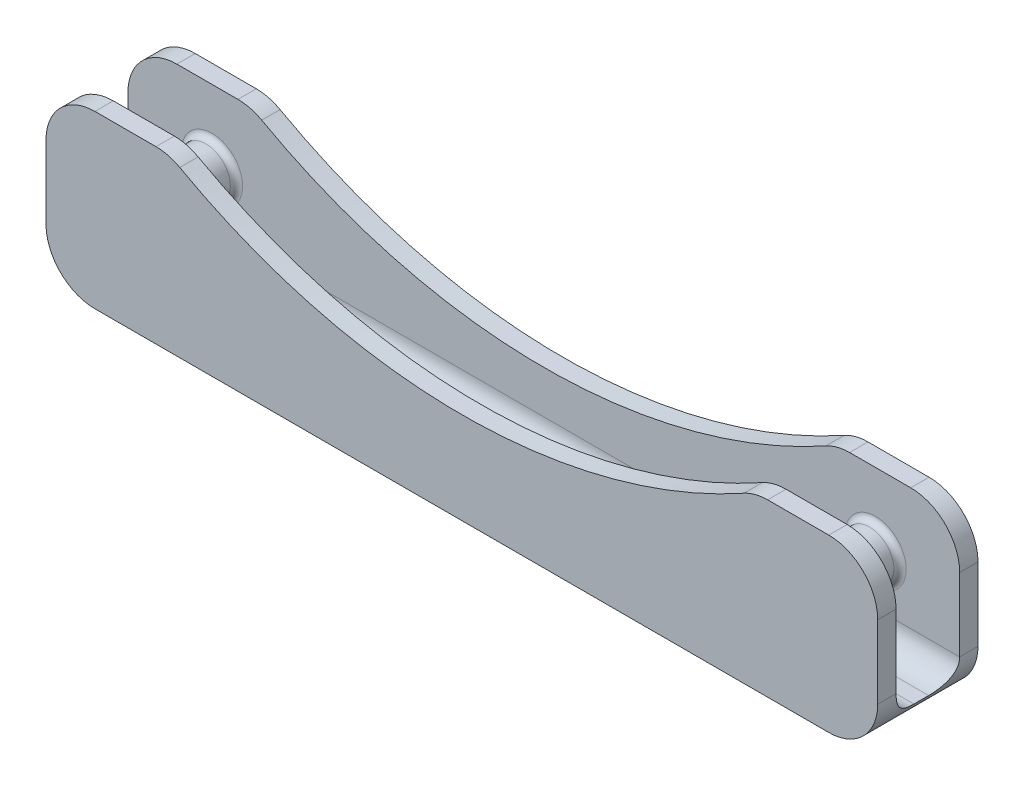
from build123d import *

# Parameters (mm, degrees)
BOSS_EXTRUDE1_DEPTH     = 3
SKETCH2_R               = 4
SKETCH2_W               = 200
SKETCH2_H               = 4
BOSS_EXTRUDE2_DEPTH     = 5.2
CUT_EXTRUDE3_DEPTH      = 149.751605033
CUT_EXTRUDE3_DEPTH_BACK = 149.751605033
SKETCH4_W               = 200.256598964
SKETCH4_H               = 45.821107358
CUT_EXTRUDE4_DEPTH      = 149.886668308
CUT_EXTRUDE4_DEPTH_BACK = 149.886668308
SKETCH5_W               = 32
SKETCH5_H               = 27.954907266
FILLET1_R               = 1
FILLET2_R               = 4
FILLET3_R               = 8
FILLET4_R               = 8


with BuildPart() as part:
    # Sketch1 → Boss-Extrude1 (new body)
    with BuildSketch(Plane.XY):
        with BuildLine():
            ThreePointArc((0, -110), (-59.410296816, -92.57654472), (-100, -45.82575695))
            Line((-100, -45.82575695), (-100, -110))
            Line((-100, -110), (0, -110))
        make_face()
        with BuildLine():
            ThreePointArc((0, -95), (-51.308892705, -79.95247044), (-86.363636364, -39.576790093))
            Line((-86.363636364, -39.576790093), (-100, -45.82575695))
            ThreePointArc((-100, -45.82575695), (-59.410296816, -92.57654472), (0, -110))
            Line((0, -110), (0, -95))
        make_face()
        with BuildLine():
            Line((100, -45.82575695), (86.363636364, -39.576790093))
            ThreePointArc((86.363636364, -39.576790093), (51.308892705, -79.95247044), (0, -95))
            Line((0, -95), (0, -110))
            ThreePointArc((0, -110), (59.410296816, -92.57654472), (100, -45.82575695))
        make_face()
        with BuildLine():
            Line((100, -110), (100, -45.82575695))
            ThreePointArc((100, -45.82575695), (59.410296816, -92.57654472), (0, -110))
            Line((0, -110), (100, -110))
        make_face()
    extrude(amount=BOSS_EXTRUDE1_DEPTH)

    # Sketch2 → Boss-Extrude2 (add)
    with BuildSketch(Plane.XY.offset(3)):
        with Locations((-54.25, -93.963756311)):
            Circle(SKETCH2_R)
        with Locations((54.25, -93.963756311)):
            Circle(SKETCH2_R)
        with Locations((0, -108)):
            Rectangle(SKETCH2_W, SKETCH2_H)
    extrude(amount=BOSS_EXTRUDE2_DEPTH)

    # Sketch4 → Cut-Extrude3 (cut, two sides: drawn at the far end of the back side and taken through both)
    with BuildSketch(Plane.XY.offset(3).offset(-CUT_EXTRUDE3_DEPTH_BACK)):
        with Locations((0.128299482, -59.134539055)):
            Rectangle(SKETCH4_W, SKETCH4_H)
    extrude(amount=CUT_EXTRUDE3_DEPTH + CUT_EXTRUDE3_DEPTH_BACK, mode=Mode.SUBTRACT)

    # Sketch5 → Cut-Extrude4 (cut, two sides: drawn at the far end of the back side and taken through both)
    with BuildSketch(Plane(origin=(0, 0, 0), x_dir=(-1, 0, 0), z_dir=(0, 0, -1)).offset(-CUT_EXTRUDE4_DEPTH_BACK)):
        with Locations((-84, -96.022546367)):
            Rectangle(SKETCH5_W, SKETCH5_H)
        with Locations((84, -96.022546367)):
            Rectangle(SKETCH5_W, SKETCH5_H)
    extrude(amount=CUT_EXTRUDE4_DEPTH + CUT_EXTRUDE4_DEPTH_BACK, mode=Mode.SUBTRACT)

    # Fillet1
    fillet1_edges = [part.edges().sort_by_distance(p)[0] for p in [
        (50.25, -93.963756311, 3),
        (-58.25, -93.963756311, 3),
    ]]
    fillet(fillet1_edges, radius=FILLET1_R)

    # Fillet2
    fillet2_edges = [part.edges().sort_by_distance(p)[0] for p in [
        (0, -106, 3),
    ]]
    fillet(fillet2_edges, radius=FILLET2_R)

    # Mirror1: part across plane


with BuildPart() as part_1:
    add(part.part)
    add(part.part.mirror(Plane.XY.offset(8.2)))

    # Fillet3
    # the kernel refuses this fillet: 8 mm, written as the material it takes off along each edge
    with BuildSketch(Plane(origin=(-68, -110, -20), x_dir=(1, 0, 0), z_dir=(0, 0, 1)), Plane(origin=(68, -110, 36.4), x_dir=(-1, 0, 0), z_dir=(0, 0, -1))) as fillet3_piece_1:
        with BuildLine():
            CenterArc((FILLET3_R, FILLET3_R), FILLET3_R, 180, 90)
            Line((0, FILLET3_R), (0, 0))
            Line((0, 0), (FILLET3_R, 0))
        make_face()
    extrude(amount=56.4, mode=Mode.SUBTRACT)
    with BuildSketch(Plane(origin=(-68, -82.045092734, -6.6), x_dir=(1, 0, 0), z_dir=(0, 0, 1)), Plane(origin=(68, -82.045092734, 36.4), x_dir=(-1, 0, 0), z_dir=(0, 0, -1))) as fillet3_piece_2:
        with BuildLine():
            CenterArc((FILLET3_R, -FILLET3_R), FILLET3_R, 90, 90)
            Line((0, -FILLET3_R), (0, 0))
            Line((0, 0), (FILLET3_R, 0))
        make_face()
    extrude(amount=43, mode=Mode.SUBTRACT)
    with BuildSketch(Plane(origin=(68, -82.045092734, -20), x_dir=(-1, 0, 0), z_dir=(0, 0, 1)), Plane(origin=(-68, -82.045092734, 23), x_dir=(1, 0, 0), z_dir=(0, 0, -1))) as fillet3_piece_3:
        with BuildLine():
            CenterArc((FILLET3_R, FILLET3_R), FILLET3_R, 180, 90)
            Line((0, FILLET3_R), (0, 0))
            Line((0, 0), (FILLET3_R, 0))
        make_face()
    extrude(amount=43, mode=Mode.SUBTRACT)

    # Fillet4
    fillet4_edges = [part_1.edges().sort_by_distance(p)[0] for p in [
        (-47.891572936, -82.045092734, 14.9),
        (47.891572936, -82.045092734, 14.9),
        (-47.891572936, -82.045092734, 1.5),
        (47.891572936, -82.045092734, 1.5),
    ]]
    fillet(fillet4_edges, radius=FILLET4_R)


solid = part_1.part
